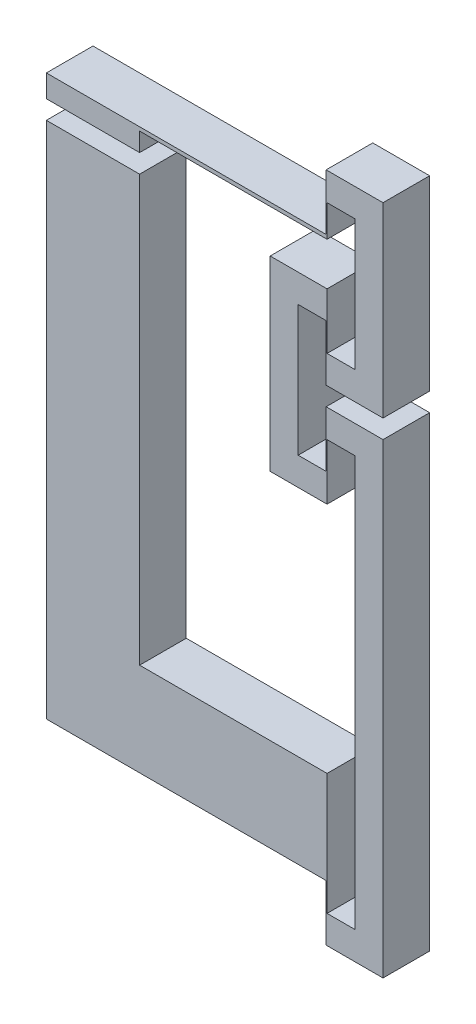
from build123d import *

# Parameters (mm, degrees)
BOSS_EXTRUDE1_DEPTH = 5


with BuildPart() as part:
    # Sketch1 → Boss-Extrude1 (new body)
    with BuildSketch(Plane.XY):
        Polygon((0, 0), (0, 55.6), (10, 55.6), (10, 10), (30.1, 10), (30.1, -3), (33.1, -3), (33.1, 41), (30.1, 41), (30.1, 36), (30.1, 35), (24, 35), (24, 55), (30.1, 55), (30.1, 52), (30.1, 49), (33.1, 49), (33.1, 63), (30.1, 63), (30.1, 60), (30.1, 59.6), (10, 59.6), (10, 57.6), (0, 57.6), (0, 60), (30, 60), (30, 66), (36.1, 66), (36.1, 46), (30, 46), (30, 52), (27, 52), (27, 38), (30, 38), (30, 44), (36.1, 44), (36.1, -6), (30, -6), (30, -3), (30, 0), align=None)
    extrude(amount=BOSS_EXTRUDE1_DEPTH)


solid = part.part
